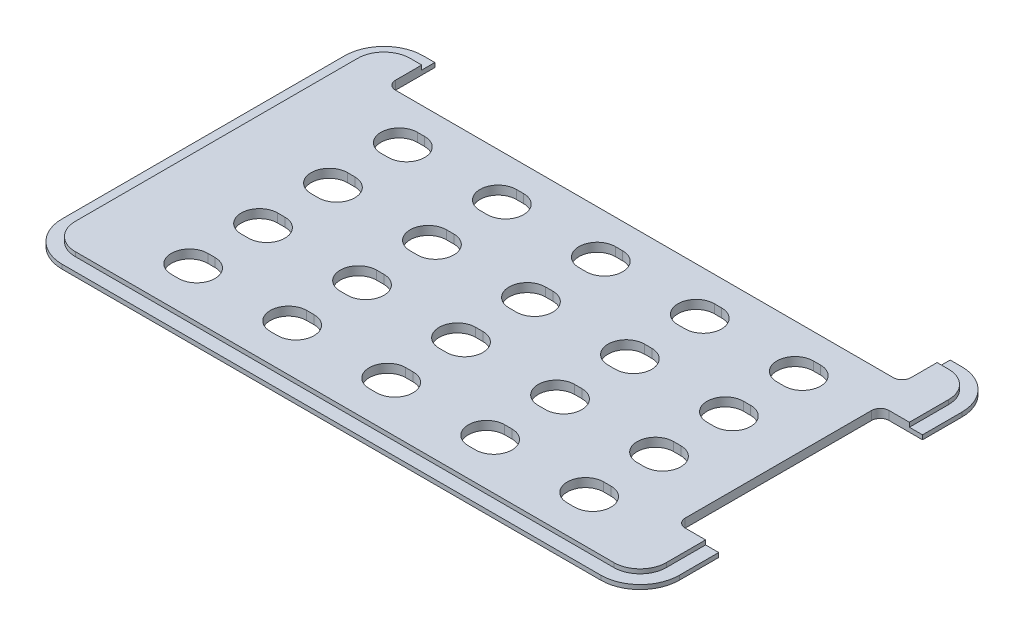
from build123d import *

# Parameters (mm, degrees)
SKETCH1_W                    = 212
SKETCH1_H                    = 124
OUTER_PROFILE_DEPTH          = 1.5
SKETCH2_W                    = 203
SKETCH2_H                    = 115
INNER_PROFILE_DEPTH          = 1.5
FILLET1_R                    = 9
FILLET2_R                    = 13.5
SKETCH4_W                    = 177
SKETCH4_H                    = 16.5
SKETCH4_W_2                  = 14.5
SKETCH4_H_2                  = 70
MESSAGE_BAR_DEPTH            = 123.837290755
CUTOUT_DEPTH                 = 123.837290755
CUTOUTS_COUNT                = 3
CUTOUTS_PITCH                = 34
CUTOUTS_COUNT_DIR2           = 4
CUTOUTS_PITCH_DIR2           = 24
MIRROR_CUTOUTS_COPY_1_DEPTH  = 123.837290755
MIRROR_CUTOUTS_COPY_2_DEPTH  = 123.837290755
MIRROR_CUTOUTS_COPY_3_DEPTH  = 123.837290755
MIRROR_CUTOUTS_COPY_4_DEPTH  = 123.837290755
MIRROR_CUTOUTS_COPY_5_DEPTH  = 123.837290755
MIRROR_CUTOUTS_COPY_6_DEPTH  = 123.837290755
MIRROR_CUTOUTS_COPY_7_DEPTH  = 123.837290755
MIRROR_CUTOUTS_COPY_8_DEPTH  = 123.837290755
MIRROR_CUTOUTS_COPY_9_DEPTH  = 123.837290755
MIRROR_CUTOUTS_COPY_10_DEPTH = 123.837290755
MIRROR_CUTOUTS_COPY_11_DEPTH = 123.837290755
MIRROR_CUTOUTS_COPY_12_DEPTH = 123.837290755
CORNER_RAD_R                 = 3


with BuildPart() as part:
    # Sketch1 → Outer Profile (new body)
    with BuildSketch(Plane(origin=(0, 0, 0), x_dir=(1, 0, 0), z_dir=(0, 1, 0))):
        Rectangle(SKETCH1_W, SKETCH1_H)
    extrude(amount=OUTER_PROFILE_DEPTH)

    # Sketch2 → Inner Profile (add)
    with BuildSketch(Plane(origin=(0, 1.5, 0), x_dir=(1, 0, 0), z_dir=(0, 1, 0))):
        Rectangle(SKETCH2_W, SKETCH2_H)
    extrude(amount=INNER_PROFILE_DEPTH)

    # Fillet1
    fillet1_edges = [part.edges().sort_by_distance(p)[0] for p in [
        (101.5, 2.25, 57.5),
        (101.5, 2.25, -57.5),
        (-101.5, 2.25, -57.5),
        (-101.5, 2.25, 57.5),
    ]]
    fillet(fillet1_edges, radius=FILLET1_R)

    # Fillet2
    fillet2_edges = [part.edges().sort_by_distance(p)[0] for p in [
        (-106, 0.75, -62),
        (106, 0.75, -62),
        (106, 0.75, 62),
        (-106, 0.75, 62),
    ]]
    fillet(fillet2_edges, radius=FILLET2_R)

    # Sketch4 → Message Bar (cut, through all)
    with BuildSketch(Plane(origin=(0, 3, 0), x_dir=(1, 0, 0), z_dir=(0, 1, 0))):
        with Locations((0, 53.75)):
            Rectangle(SKETCH4_W, SKETCH4_H)
        with Locations((98.75, 0)):
            Rectangle(SKETCH4_W_2, SKETCH4_H_2)
    extrude(amount=-MESSAGE_BAR_DEPTH, mode=Mode.SUBTRACT)

    # Sketch5 → Cutout (cut, through all)
    with BuildSketch(Plane(origin=(0, 3, 0), x_dir=(1, 0, 0), z_dir=(0, 1, 0))):
        with BuildLine():
            Line((-1.25, -35.25), (1.25, -35.25))
            ThreePointArc((1.25, -35.25), (7.5, -41.5), (1.25, -47.75))
            Line((1.25, -47.75), (-1.25, -47.75))
            ThreePointArc((-1.25, -47.75), (-7.5, -41.5), (-1.25, -35.25))
        make_face()
    cutout = extrude(amount=-CUTOUT_DEPTH, mode=Mode.SUBTRACT)

    # Cutouts: Cutout 3 × 4
    with Locations(*[(-i * CUTOUTS_PITCH, 0, -j * CUTOUTS_PITCH_DIR2) for i in range(CUTOUTS_COUNT) for j in range(CUTOUTS_COUNT_DIR2) if (i, j) != (0, 0)]):
        add(cutout, mode=Mode.SUBTRACT)

    # Mirror Cutouts copy 1 sketch → Mirror Cutouts copy 1 (cut, through all)
    with BuildSketch(Plane(origin=(0, 3, -24), x_dir=(-1, 0, 0), z_dir=(0, 1, 0))):
        with BuildLine():
            Line((-1.25, 35.25), (1.25, 35.25))
            ThreePointArc((1.25, 35.25), (7.5, 41.5), (1.25, 47.75))
            Line((1.25, 47.75), (-1.25, 47.75))
            ThreePointArc((-1.25, 47.75), (-7.5, 41.5), (-1.25, 35.25))
        make_face()
    extrude(amount=-MIRROR_CUTOUTS_COPY_1_DEPTH, mode=Mode.SUBTRACT)

    # Mirror Cutouts copy 2 sketch → Mirror Cutouts copy 2 (cut, through all)
    with BuildSketch(Plane(origin=(0, 3, -48), x_dir=(-1, 0, 0), z_dir=(0, 1, 0))):
        with BuildLine():
            Line((-1.25, 35.25), (1.25, 35.25))
            ThreePointArc((1.25, 35.25), (7.5, 41.5), (1.25, 47.75))
            Line((1.25, 47.75), (-1.25, 47.75))
            ThreePointArc((-1.25, 47.75), (-7.5, 41.5), (-1.25, 35.25))
        make_face()
    extrude(amount=-MIRROR_CUTOUTS_COPY_2_DEPTH, mode=Mode.SUBTRACT)

    # Mirror Cutouts copy 3 sketch → Mirror Cutouts copy 3 (cut, through all)
    with BuildSketch(Plane(origin=(0, 3, -72), x_dir=(-1, 0, 0), z_dir=(0, 1, 0))):
        with BuildLine():
            Line((-1.25, 35.25), (1.25, 35.25))
            ThreePointArc((1.25, 35.25), (7.5, 41.5), (1.25, 47.75))
            Line((1.25, 47.75), (-1.25, 47.75))
            ThreePointArc((-1.25, 47.75), (-7.5, 41.5), (-1.25, 35.25))
        make_face()
    extrude(amount=-MIRROR_CUTOUTS_COPY_3_DEPTH, mode=Mode.SUBTRACT)

    # Mirror Cutouts copy 4 sketch → Mirror Cutouts copy 4 (cut, through all)
    with BuildSketch(Plane(origin=(34, 3, 0), x_dir=(-1, 0, 0), z_dir=(0, 1, 0))):
        with BuildLine():
            Line((-1.25, 35.25), (1.25, 35.25))
            ThreePointArc((1.25, 35.25), (7.5, 41.5), (1.25, 47.75))
            Line((1.25, 47.75), (-1.25, 47.75))
            ThreePointArc((-1.25, 47.75), (-7.5, 41.5), (-1.25, 35.25))
        make_face()
    extrude(amount=-MIRROR_CUTOUTS_COPY_4_DEPTH, mode=Mode.SUBTRACT)

    # Mirror Cutouts copy 5 sketch → Mirror Cutouts copy 5 (cut, through all)
    with BuildSketch(Plane(origin=(34, 3, -24), x_dir=(-1, 0, 0), z_dir=(0, 1, 0))):
        with BuildLine():
            Line((-1.25, 35.25), (1.25, 35.25))
            ThreePointArc((1.25, 35.25), (7.5, 41.5), (1.25, 47.75))
            Line((1.25, 47.75), (-1.25, 47.75))
            ThreePointArc((-1.25, 47.75), (-7.5, 41.5), (-1.25, 35.25))
        make_face()
    extrude(amount=-MIRROR_CUTOUTS_COPY_5_DEPTH, mode=Mode.SUBTRACT)

    # Mirror Cutouts copy 6 sketch → Mirror Cutouts copy 6 (cut, through all)
    with BuildSketch(Plane(origin=(34, 3, -48), x_dir=(-1, 0, 0), z_dir=(0, 1, 0))):
        with BuildLine():
            Line((-1.25, 35.25), (1.25, 35.25))
            ThreePointArc((1.25, 35.25), (7.5, 41.5), (1.25, 47.75))
            Line((1.25, 47.75), (-1.25, 47.75))
            ThreePointArc((-1.25, 47.75), (-7.5, 41.5), (-1.25, 35.25))
        make_face()
    extrude(amount=-MIRROR_CUTOUTS_COPY_6_DEPTH, mode=Mode.SUBTRACT)

    # Mirror Cutouts copy 7 sketch → Mirror Cutouts copy 7 (cut, through all)
    with BuildSketch(Plane(origin=(34, 3, -72), x_dir=(-1, 0, 0), z_dir=(0, 1, 0))):
        with BuildLine():
            Line((-1.25, 35.25), (1.25, 35.25))
            ThreePointArc((1.25, 35.25), (7.5, 41.5), (1.25, 47.75))
            Line((1.25, 47.75), (-1.25, 47.75))
            ThreePointArc((-1.25, 47.75), (-7.5, 41.5), (-1.25, 35.25))
        make_face()
    extrude(amount=-MIRROR_CUTOUTS_COPY_7_DEPTH, mode=Mode.SUBTRACT)

    # Mirror Cutouts copy 8 sketch → Mirror Cutouts copy 8 (cut, through all)
    with BuildSketch(Plane(origin=(68, 3, 0), x_dir=(-1, 0, 0), z_dir=(0, 1, 0))):
        with BuildLine():
            Line((-1.25, 35.25), (1.25, 35.25))
            ThreePointArc((1.25, 35.25), (7.5, 41.5), (1.25, 47.75))
            Line((1.25, 47.75), (-1.25, 47.75))
            ThreePointArc((-1.25, 47.75), (-7.5, 41.5), (-1.25, 35.25))
        make_face()
    extrude(amount=-MIRROR_CUTOUTS_COPY_8_DEPTH, mode=Mode.SUBTRACT)

    # Mirror Cutouts copy 9 sketch → Mirror Cutouts copy 9 (cut, through all)
    with BuildSketch(Plane(origin=(68, 3, -24), x_dir=(-1, 0, 0), z_dir=(0, 1, 0))):
        with BuildLine():
            Line((-1.25, 35.25), (1.25, 35.25))
            ThreePointArc((1.25, 35.25), (7.5, 41.5), (1.25, 47.75))
            Line((1.25, 47.75), (-1.25, 47.75))
            ThreePointArc((-1.25, 47.75), (-7.5, 41.5), (-1.25, 35.25))
        make_face()
    extrude(amount=-MIRROR_CUTOUTS_COPY_9_DEPTH, mode=Mode.SUBTRACT)

    # Mirror Cutouts copy 10 sketch → Mirror Cutouts copy 10 (cut, through all)
    with BuildSketch(Plane(origin=(68, 3, -48), x_dir=(-1, 0, 0), z_dir=(0, 1, 0))):
        with BuildLine():
            Line((-1.25, 35.25), (1.25, 35.25))
            ThreePointArc((1.25, 35.25), (7.5, 41.5), (1.25, 47.75))
            Line((1.25, 47.75), (-1.25, 47.75))
            ThreePointArc((-1.25, 47.75), (-7.5, 41.5), (-1.25, 35.25))
        make_face()
    extrude(amount=-MIRROR_CUTOUTS_COPY_10_DEPTH, mode=Mode.SUBTRACT)

    # Mirror Cutouts copy 11 sketch → Mirror Cutouts copy 11 (cut, through all)
    with BuildSketch(Plane(origin=(68, 3, -72), x_dir=(-1, 0, 0), z_dir=(0, 1, 0))):
        with BuildLine():
            Line((-1.25, 35.25), (1.25, 35.25))
            ThreePointArc((1.25, 35.25), (7.5, 41.5), (1.25, 47.75))
            Line((1.25, 47.75), (-1.25, 47.75))
            ThreePointArc((-1.25, 47.75), (-7.5, 41.5), (-1.25, 35.25))
        make_face()
    extrude(amount=-MIRROR_CUTOUTS_COPY_11_DEPTH, mode=Mode.SUBTRACT)

    # Mirror Cutouts copy 12 sketch → Mirror Cutouts copy 12 (cut, through all)
    with BuildSketch(Plane(origin=(0, 3, 0), x_dir=(-1, 0, 0), z_dir=(0, 1, 0))):
        with BuildLine():
            Line((-1.25, 35.25), (1.25, 35.25))
            ThreePointArc((1.25, 35.25), (7.5, 41.5), (1.25, 47.75))
            Line((1.25, 47.75), (-1.25, 47.75))
            ThreePointArc((-1.25, 47.75), (-7.5, 41.5), (-1.25, 35.25))
        make_face()
    extrude(amount=-MIRROR_CUTOUTS_COPY_12_DEPTH, mode=Mode.SUBTRACT)

    # Corner Rad
    corner_rad_edges = [part.edges().sort_by_distance(p)[0] for p in [
        (88.5, 1.5, -45.5),
        (-88.5, 1.5, -45.5),
        (91.5, 1.5, 35),
        (91.5, 1.5, -35),
    ]]
    fillet(corner_rad_edges, radius=CORNER_RAD_R)


solid = part.part
